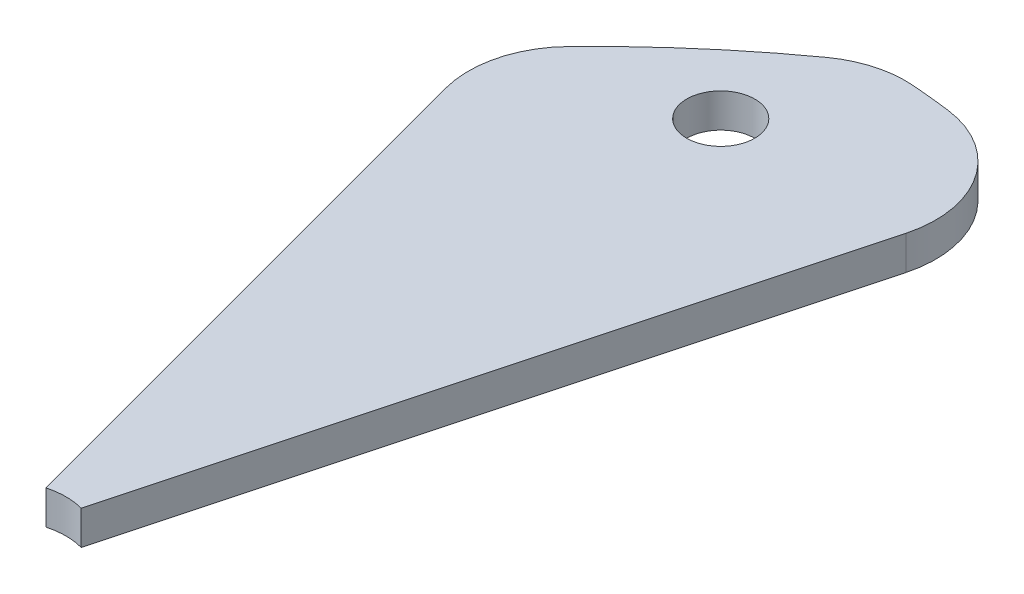
from build123d import *

# Parameters (mm, degrees)
SKETCH1_R           = 2
BOSS_EXTRUDE1_DEPTH = 2
CUT_EXTRUDE1_START  = -2
CUT_EXTRUDE1_DEPTH  = 2
FILLET1_R           = 6
BOSS_EXTRUDE2_DEPTH = 1


# Read off the part's stored shape, not the designer's step: Cut-Extrude1
with BuildPart() as part:
    # Sketch1 → Boss-Extrude1 (new body)
    with BuildSketch(Plane(origin=(0, 0, 0), x_dir=(1, 0, 0), z_dir=(0, 1, 0))):
        with BuildLine():
            Line((-1.03527618, 3.863703305), (-12.940952255, 48.296291314))
            ThreePointArc((-12.940952255, 48.296291314), (0, 50), (12.940952255, 48.296291314))
            Line((12.940952255, 48.296291314), (1.03527618, 3.863703305))
            ThreePointArc((1.03527618, 3.863703305), (0, 4), (-1.03527618, 3.863703305))
        make_face()
        with Locations(Location((0, 42.5, 0), (0, 0, 270))):
            Circle(SKETCH1_R, mode=Mode.SUBTRACT)
    extrude(amount=BOSS_EXTRUDE1_DEPTH)

    # Cut-Extrude1 outline → Cut-Extrude1 (cut)
    with BuildSketch(Plane(origin=(0, 2, 0), x_dir=(1, 0, 0), z_dir=(0, 1, 0)).offset(CUT_EXTRUDE1_START)):
        with BuildLine():
            ThreePointArc((-10.484777097, 39.129720832), (-4.720942194, 44.969397941), (1.785714286, 49.96810207))
            ThreePointArc((1.785714286, 49.96810207), (-5.639908806, 49.680896013), (-12.940952255, 48.296291314))
            Line((-12.940952255, 48.296291314), (-10.484777097, 39.129720832))
        make_face()
    extrude(amount=CUT_EXTRUDE1_DEPTH, mode=Mode.SUBTRACT)

    # Fillet1
    fillet1_edges = [part.edges().sort_by_distance(p)[0] for p in [
        (12.940952255, 1, -48.296291314),
        (-10.484777097, 1, -39.129720832),
        (1.785714286, 1, -49.96810207),
    ]]
    fillet(fillet1_edges, radius=FILLET1_R)

    # Sketch4 → Boss-Extrude2 (add)
    with BuildSketch(Plane.XZ):
        with BuildLine():
            Line((-1.5, -37.5), (1.5, -37.5))
            ThreePointArc((1.5, -37.5), (2, -38), (1.5, -38.5))
            Line((1.5, -38.5), (-1.5, -38.5))
            ThreePointArc((-1.5, -38.5), (-2, -38), (-1.5, -37.5))
        make_face()
    extrude(amount=BOSS_EXTRUDE2_DEPTH)


solid = part.part
